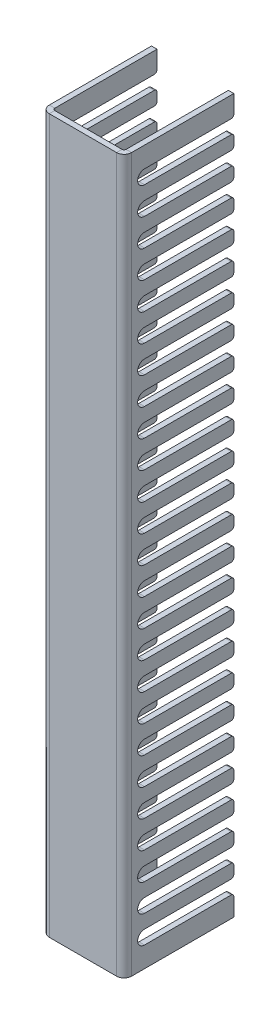
from build123d import *

# Parameters (mm, degrees)
SKETCH_1_W                         = 30
SKETCH_1_H                         = 260
SM_BASE_FLANGE_1_DEPTH             = 2
SM_EDGE_FLANGE_1_STRIP_W           = 9.4732
SM_EDGE_FLANGE_1_STRIP_H           = 2
SM_EDGE_FLANGE_1_STRIP_CUT_DEPTH   = 260
SM_EDGE_FLANGE_1_STRIP_2_W         = 9.4732
SM_EDGE_FLANGE_1_STRIP_2_H         = 2
SM_EDGE_FLANGE_1_STRIP_CUT_2_DEPTH = 260
SM_EDGE_FLANGE_1_DEPTH             = 260
SM_EDGE_FLANGE_1_BEND_DEPTH        = 260
CUT_EXTRUDE_1_DEPTH                = 30
PATTERN_LINEAR_1_COUNT             = 25
PATTERN_LINEAR_1_PITCH             = 10


# Sheet-metal steps are written as plain solids
with BuildPart() as part:
    # Sketch 1 → 基体-法兰1 (new body)
    with BuildSketch(Plane.XY):
        with Locations((-3.013245033, -94.311258278)):
            Rectangle(SKETCH_1_W, SKETCH_1_H)
    extrude(amount=-SM_BASE_FLANGE_1_DEPTH)

    # 边线-法兰1 strip (across the edge) → 边线-法兰1 strip cut (cut)
    with BuildSketch(Plane(origin=(11.986754967, 35.688741722, -2), x_dir=(-1, 0, 0), z_dir=(0, -1, 0))):
        with Locations((-2, -1)):
            Rectangle(SM_EDGE_FLANGE_1_STRIP_W, SM_EDGE_FLANGE_1_STRIP_H)
    extrude(amount=SM_EDGE_FLANGE_1_STRIP_CUT_DEPTH, mode=Mode.SUBTRACT)

    # 边线-法兰1 strip 2 (across the edge) → 边线-法兰1 strip cut 2 (cut)
    with BuildSketch(Plane(origin=(-18.013245033, -224.311258278, -2), x_dir=(1, 0, 0), z_dir=(0, 1, 0))):
        with Locations((-2, -1)):
            Rectangle(SM_EDGE_FLANGE_1_STRIP_2_W, SM_EDGE_FLANGE_1_STRIP_2_H)
    extrude(amount=SM_EDGE_FLANGE_1_STRIP_CUT_2_DEPTH, mode=Mode.SUBTRACT)

    # 边线-法兰1 section (across the edge) → 边线-法兰1 (add)
    with BuildSketch(Plane(origin=(11.986754967, 35.688741722, -2), x_dir=(-1, 0, 0), z_dir=(0, -1, 0))):
        with BuildLine():
            Line((0, 0.7366), (0, 38))
            Line((0, 38), (2, 38))
            Line((2, 38), (2, 0.7366))
            ThreePointArc((2, 0.7366), (2.215745145, 0.215745145), (2.7366, 0))
            Line((2.7366, 0), (2.7366, -2))
            ThreePointArc((2.7366, -2), (0.801531583, -1.198468417), (0, 0.7366))
        make_face()
    extrude(amount=SM_EDGE_FLANGE_1_DEPTH)

    # 边线-法兰1 section 2 (across the edge) → 边线-法兰1 bend (add)
    with BuildSketch(Plane(origin=(-18.013245033, -224.311258278, -2), x_dir=(1, 0, 0), z_dir=(0, 1, 0))):
        with BuildLine():
            Line((0, 0.7366), (0, 38))
            Line((0, 38), (2, 38))
            Line((2, 38), (2, 0.7366))
            ThreePointArc((2, 0.7366), (2.215745145, 0.215745145), (2.7366, 0))
            Line((2.7366, 0), (2.7366, -2))
            ThreePointArc((2.7366, -2), (0.801531583, -1.198468417), (0, 0.7366))
        make_face()
    extrude(amount=SM_EDGE_FLANGE_1_BEND_DEPTH)

    # 草图11 → 切除-拉伸1 (cut)
    with BuildSketch(Plane.ZY.offset(18.013245033)):
        with BuildLine():
            Line((-7.450035612, 28.188741722), (-39, 28.188741722))
            ThreePointArc((-39, 28.188741722), (-39.707106781, 28.481634941), (-40, 29.188741722))
            Line((-40, 29.188741722), (-40, 22.188741722))
            ThreePointArc((-40, 22.188741722), (-39.707106781, 22.895848503), (-39, 23.188741722))
            Line((-39, 23.188741722), (-7.450035612, 23.188741722))
            ThreePointArc((-7.450035612, 23.188741722), (-4.950035612, 25.688741722), (-7.450035612, 28.188741722))
        make_face()
    cut_extrude_1 = extrude(amount=-CUT_EXTRUDE_1_DEPTH, mode=Mode.SUBTRACT)

    # 阵列(线性)1: 切除-拉伸1 ×25
    with Locations(*[(0, -i * PATTERN_LINEAR_1_PITCH, 0) for i in range(1, PATTERN_LINEAR_1_COUNT)]):
        add(cut_extrude_1, mode=Mode.SUBTRACT)


solid = part.part
